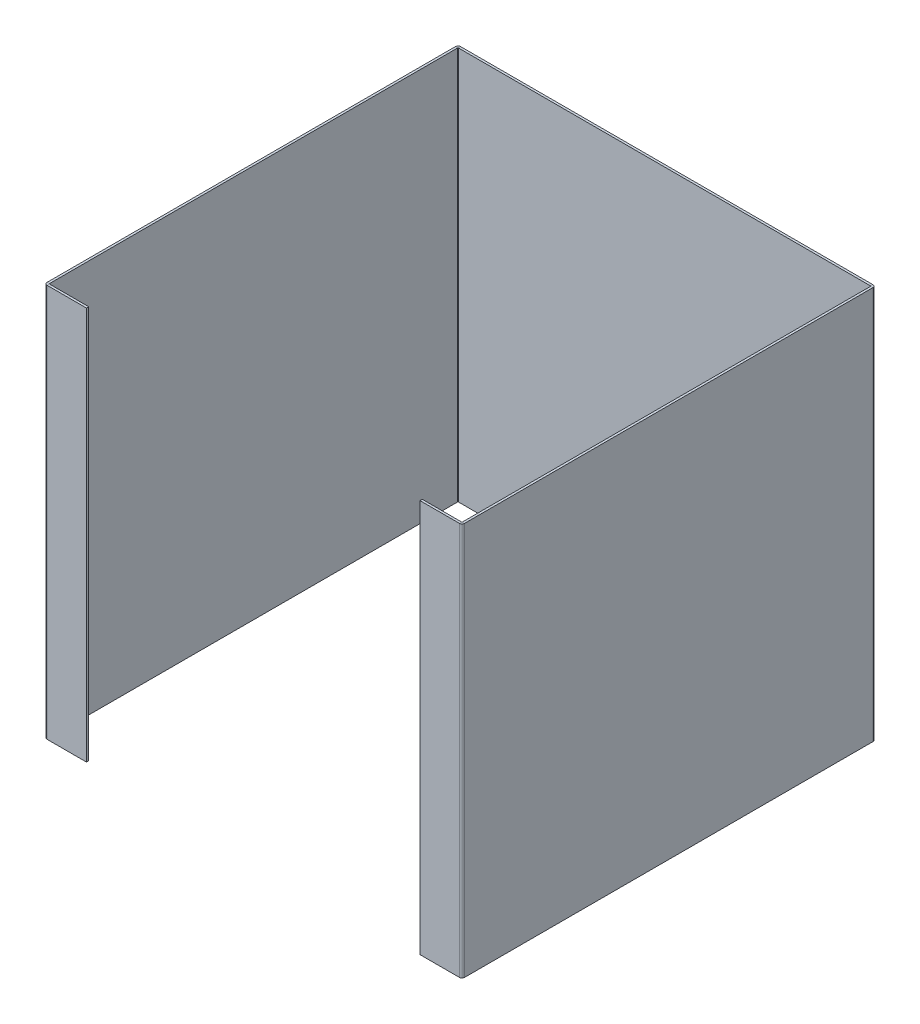
from build123d import *

# Parameters (mm, degrees)
SKETCH1_W              = 398.11784
SKETCH1_H              = 394.318
SKETCH1_W_2            = 393.79984
SKETCH1_H_2            = 390
EXTRUDE_THIN1_DEPTH    = 375
CUT_EXTRUDE1_REACH     = 581.427
SKETCH2_W              = 318.11784
SKETCH2_H              = 375
CONVERT_SOLID1_START   = -375
CONVERT_SOLID1_DEPTH   = 375
CONVERT_SOLID1_2_DEPTH = 375


# Read off the part's stored shape, not the designer's step: Convert-Solid1
with BuildPart() as part:
    # Sketch1 → Extrude-Thin1 (new body)
    with BuildSketch(Plane(origin=(0, 0, 0), x_dir=(1, 0, 0), z_dir=(0, 1, 0))):
        Rectangle(SKETCH1_W, SKETCH1_H)
        Rectangle(SKETCH1_W_2, SKETCH1_H_2, mode=Mode.SUBTRACT)
    extrude(amount=-EXTRUDE_THIN1_DEPTH)

    # Sketch2 → Cut-Extrude1 (cut, up to next)
    with BuildSketch(Plane.XY.offset(197.159), mode=Mode.PRIVATE) as cut_extrude1_sk1:
        with Locations((0, -187.5)):
            Rectangle(SKETCH2_W, SKETCH2_H)
    cut_extrude1_tool1 = extrude(cut_extrude1_sk1.sketch, amount=-CUT_EXTRUDE1_REACH, mode=Mode.PRIVATE) & part.part
    add(cut_extrude1_tool1.solids().sort_by_distance((0, -187.5, 197.159))[0], mode=Mode.SUBTRACT)

    # Convert-Solid1 outline → Convert-Solid1 (cut)
    with BuildSketch(Plane(origin=(0, 0, 0), x_dir=(1, 0, 0), z_dir=(0, 1, 0)).offset(CONVERT_SOLID1_START)):
        with BuildLine():
            Line((199.05892, -197.159), (199.05892, -194.619))
            ThreePointArc((199.05892, -194.619), (198.314971224, -196.415051224), (196.51892, -197.159))
            Line((196.51892, -197.159), (199.05892, -197.159))
        make_face()
        with BuildLine():
            Line((199.05892, 197.159), (196.51892, 197.159))
            ThreePointArc((196.51892, 197.159), (198.314971224, 196.415051224), (199.05892, 194.619))
            Line((199.05892, 194.619), (199.05892, 197.159))
        make_face()
        with BuildLine():
            Line((-199.05892, 197.159), (-199.05892, 194.619))
            ThreePointArc((-199.05892, 194.619), (-198.314971224, 196.415051224), (-196.51892, 197.159))
            Line((-196.51892, 197.159), (-199.05892, 197.159))
        make_face()
        with BuildLine():
            ThreePointArc((-196.51892, -197.159), (-198.314971224, -196.415051224), (-199.05892, -194.619))
            Line((-199.05892, -194.619), (-199.05892, -197.159))
            Line((-199.05892, -197.159), (-196.51892, -197.159))
        make_face()
    extrude(amount=CONVERT_SOLID1_DEPTH, mode=Mode.SUBTRACT)

    # Convert-Solid1 2 outline → Convert-Solid1 2 (add)
    with BuildSketch(Plane(origin=(0, 0, 0), x_dir=(1, 0, 0), z_dir=(0, 1, 0)).offset(CONVERT_SOLID1_START)):
        with BuildLine():
            Line((196.89992, -195), (196.89992, -194.619))
            ThreePointArc((196.89992, -194.619), (196.788327684, -194.888407684), (196.51892, -195))
            Line((196.51892, -195), (196.89992, -195))
        make_face()
        with BuildLine():
            Line((196.89992, 195), (196.51892, 195))
            ThreePointArc((196.51892, 195), (196.788327684, 194.888407684), (196.89992, 194.619))
            Line((196.89992, 194.619), (196.89992, 195))
        make_face()
        with BuildLine():
            Line((-196.89992, 195), (-196.89992, 194.619))
            ThreePointArc((-196.89992, 194.619), (-196.788327684, 194.888407684), (-196.51892, 195))
            Line((-196.51892, 195), (-196.89992, 195))
        make_face()
        with BuildLine():
            ThreePointArc((-196.51892, -195), (-196.788327684, -194.888407684), (-196.89992, -194.619))
            Line((-196.89992, -194.619), (-196.89992, -195))
            Line((-196.89992, -195), (-196.51892, -195))
        make_face()
    extrude(amount=CONVERT_SOLID1_2_DEPTH)


solid = part.part
